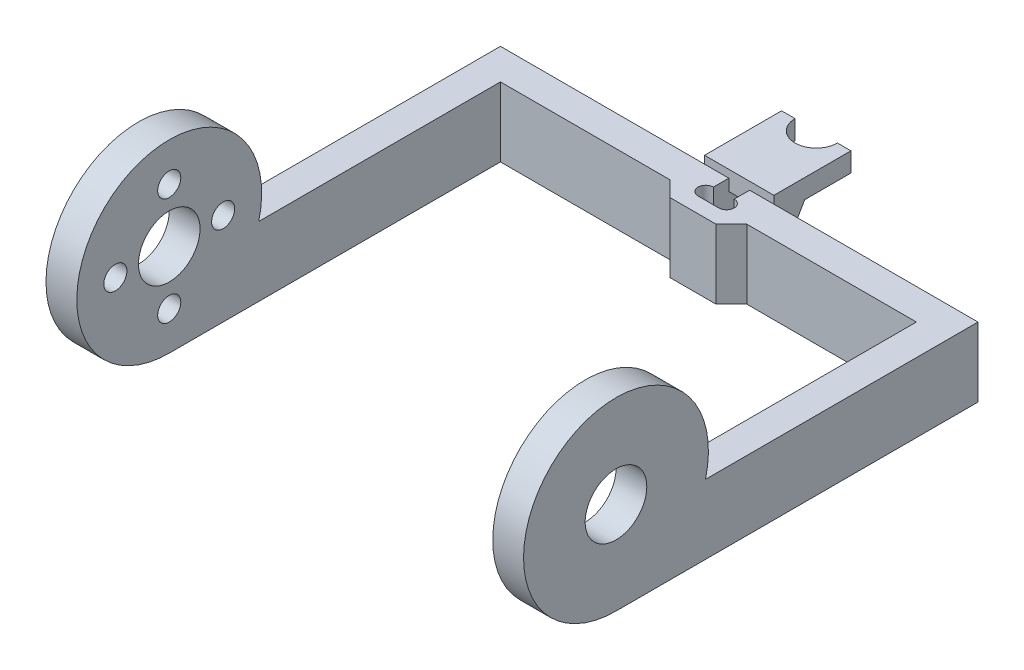
from build123d import *

# Parameters (mm, degrees)
BOSS_EXTRUDE1_DEPTH      = 62
CUT_EXTRUDE1_DEPTH       = 12
CUT_EXTRUDE1_DEPTH_BACK  = 12
BOSS_EXTRUDE2_DEPTH      = 1
BOSS_EXTRUDE2_DEPTH_BACK = 1.5
CUT_EXTRUDE3_DEPTH       = 10
CHAMFER2_SIZE            = 2
CHAMFER3_SIZE            = 2
CHAMFER4_SIZE            = 4
CHAMFER4_SIZE2           = 6.92820323
SKETCH7_R                = 4
CUT_EXTRUDE4_DEPTH       = 70
CUT_EXTRUDE5_REACH       = 87.071
SKETCH8_R                = 1.5


with BuildPart() as part:
    # Sketch1 → Boss-Extrude1 (new body)
    with BuildSketch(Plane(origin=(0, 0, 0), x_dir=(0, 0, -1), z_dir=(1, 0, 0))):
        with BuildLine():
            Line((47, -12), (0, -12))
            ThreePointArc((0, -12), (-7.348469228, 9.486832981), (11.618950039, -3))
            Line((11.618950039, -3), (47, -3))
            Line((47, -3), (47, -12))
        make_face()
    extrude(amount=-BOSS_EXTRUDE1_DEPTH)

    # Sketch2 → Cut-Extrude1 (cut, two sides: drawn at the far end of the back side and taken through both)
    with BuildSketch(Plane(origin=(0, 0, 0), x_dir=(1, 0, 0), z_dir=(0, 1, 0)).offset(-CUT_EXTRUDE1_DEPTH_BACK)):
        Polygon((-58, -12), (-58, 43), (-36, 43), (-36, 41), (-26, 41), (-26, 43), (-4, 43), (-4, -12), align=None)
    extrude(amount=CUT_EXTRUDE1_DEPTH + CUT_EXTRUDE1_DEPTH_BACK, mode=Mode.SUBTRACT)

    # Sketch3 → Boss-Extrude2 (add, two sides: drawn at the far end of the back side and taken through both)
    with BuildSketch(Plane(origin=(0, -3, 0), x_dir=(1, 0, 0), z_dir=(0, 1, 0)).offset(-BOSS_EXTRUDE2_DEPTH_BACK)):
        with BuildLine():
            Line((-35.5, 57), (-35.5, 47))
            Line((-35.5, 47), (-26.5, 47))
            Line((-26.5, 47), (-26.5, 57))
            Line((-26.5, 57), (-28.25, 57))
            ThreePointArc((-28.25, 57), (-31, 54.25), (-33.75, 57))
            Line((-33.75, 57), (-35.5, 57))
        make_face()
    extrude(amount=BOSS_EXTRUDE2_DEPTH + BOSS_EXTRUDE2_DEPTH_BACK)

    # Sketch5 → Cut-Extrude3 (cut)
    with BuildSketch(Plane(origin=(0, -3, 0), x_dir=(1, 0, 0), z_dir=(0, 1, 0))):
        with BuildLine():
            Line((-32.35, 43), (-29.65, 43))
            ThreePointArc((-29.65, 43), (-28.65, 44), (-29.65, 45))
            Line((-29.65, 45), (-29.65, 47))
            Line((-29.65, 47), (-32.35, 47))
            Line((-32.35, 47), (-32.35, 45))
            ThreePointArc((-32.35, 45), (-33.35, 44), (-32.35, 43))
        make_face()
    extrude(amount=-CUT_EXTRUDE3_DEPTH, mode=Mode.SUBTRACT)

    # Chamfer2
    chamfer2_edges = [part.edges().sort_by_distance(p)[0] for p in [
        (-26, -7.5, -41),
    ]]
    chamfer(chamfer2_edges, length=CHAMFER2_SIZE - 0.0001)  # a hair under: the kernel refuses the full size

    # Chamfer3
    chamfer3_edges = [part.edges().sort_by_distance(p)[0] for p in [
        (-36, -7.5, -41),
    ]]
    chamfer(chamfer3_edges, length=CHAMFER3_SIZE - 0.0001)  # a hair under: the kernel refuses the full size

    # Chamfer4
    chamfer4_edges = [part.edges().sort_by_distance(p)[0] for p in [
        (-33.925, -4.5, -47),
        (-28.075, -4.5, -47),
    ]]
    chamfer4_side = [part.faces().sort_by_distance(p)[0] for p in [
        (-31, -4.5, -51.417170305),
    ]]
    chamfer(chamfer4_edges, length=CHAMFER4_SIZE, length2=CHAMFER4_SIZE2, reference=chamfer4_side[0])

    # Sketch7 → Cut-Extrude4 (cut)
    with BuildSketch(Plane(origin=(0, 0, 0), x_dir=(0, 0, -1), z_dir=(1, 0, 0))):
        Circle(SKETCH7_R)
    extrude(amount=-CUT_EXTRUDE4_DEPTH, mode=Mode.SUBTRACT)

    # Sketch8 → Cut-Extrude5 (cut, up to next)
    with BuildSketch(Plane.ZY.offset(62), mode=Mode.PRIVATE) as cut_extrude5_sk1:
        with Locations((0, 7)):
            Circle(SKETCH8_R)
    cut_extrude5_tool1 = extrude(cut_extrude5_sk1.sketch, amount=-CUT_EXTRUDE5_REACH, mode=Mode.PRIVATE) & part.part
    # Sketch8 → Cut-Extrude5 (cut, up to next)
    with BuildSketch(Plane.ZY.offset(62), mode=Mode.PRIVATE) as cut_extrude5_sk2:
        with Locations((7, 0)):
            Circle(SKETCH8_R)
    cut_extrude5_tool2 = extrude(cut_extrude5_sk2.sketch, amount=-CUT_EXTRUDE5_REACH, mode=Mode.PRIVATE) & part.part
    # Sketch8 → Cut-Extrude5 (cut, up to next)
    with BuildSketch(Plane.ZY.offset(62), mode=Mode.PRIVATE) as cut_extrude5_sk3:
        with Locations((0, -7)):
            Circle(SKETCH8_R)
    cut_extrude5_tool3 = extrude(cut_extrude5_sk3.sketch, amount=-CUT_EXTRUDE5_REACH, mode=Mode.PRIVATE) & part.part
    # Sketch8 → Cut-Extrude5 (cut, up to next)
    with BuildSketch(Plane.ZY.offset(62), mode=Mode.PRIVATE) as cut_extrude5_sk4:
        with Locations((-7, 0)):
            Circle(SKETCH8_R)
    cut_extrude5_tool4 = extrude(cut_extrude5_sk4.sketch, amount=-CUT_EXTRUDE5_REACH, mode=Mode.PRIVATE) & part.part
    add(cut_extrude5_tool1.solids().sort_by_distance((-62, 7, 0))[0], mode=Mode.SUBTRACT)
    add(cut_extrude5_tool2.solids().sort_by_distance((-62, 0, 7))[0], mode=Mode.SUBTRACT)
    add(cut_extrude5_tool3.solids().sort_by_distance((-62, -7, 0))[0], mode=Mode.SUBTRACT)
    add(cut_extrude5_tool4.solids().sort_by_distance((-62, 0, -7))[0], mode=Mode.SUBTRACT)


solid = part.part
